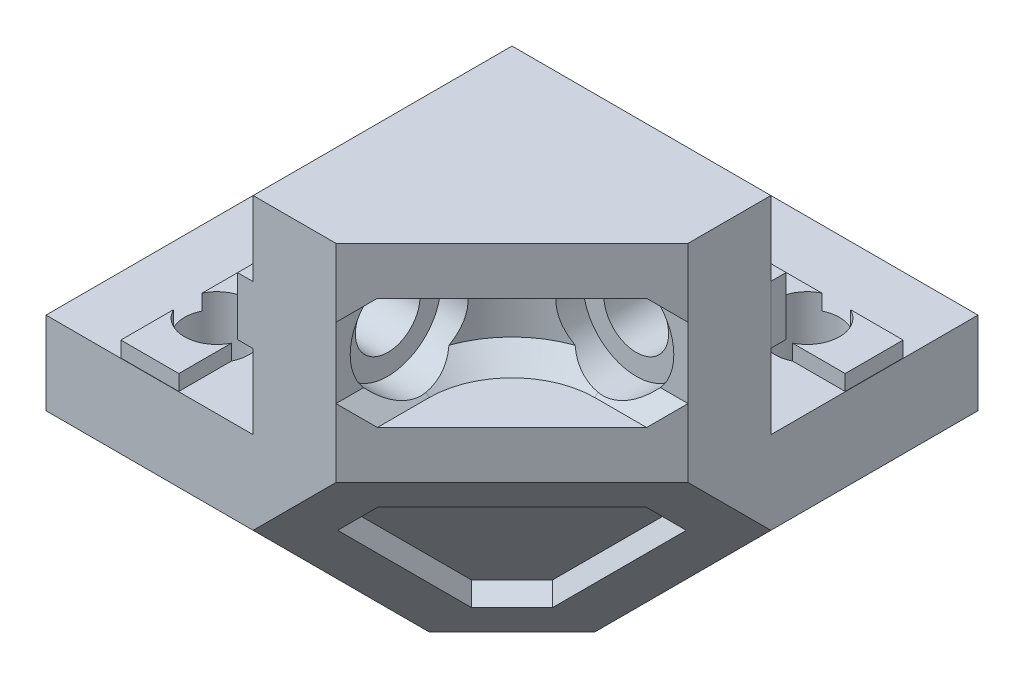
from build123d import *

# Parameters (mm, degrees)
EXTRUDE_C0_DEPTH        = 20
RIB8_REACH              = 42.62
SKETCH33_WALL_W         = 107.282014606
SKETCH33_WALL_H         = 4.6
RIB9_START              = -4.6
RIB9_DEPTH              = 4.6
FILLET2_R               = 10
SKETCH26_W              = 20
SKETCH26_H              = 1.5
BOSS_EXTRUDE13_DEPTH    = 2.8
SKETCH27_W              = 1.5
SKETCH27_H              = 20
BOSS_EXTRUDE14_DEPTH    = 2.8
CUT_EXTRUDE1_START      = 5
SKETCH10_R              = 3.125
CUT_EXTRUDE1_DEPTH      = 50
CUT_EXTRUDE2_START      = -6.5
SKETCH11_R              = 5.125
CUT_EXTRUDE2_DEPTH      = 50
CUT_EXTRUDE3_START      = 5
SKETCH12_R              = 3.125
CUT_EXTRUDE3_DEPTH      = 50
CUT_EXTRUDE4_START      = -6.5
SKETCH13_R              = 5.125
CUT_EXTRUDE4_DEPTH      = 50
CUT_EXTRUDE5_DEPTH      = 3
CHAMFER1_SIZE           = 2
PATTERN_LINEAR_C1_COUNT = 2
PATTERN_LINEAR_C1_PITCH = 30
C1ROT_ANGLE             = 90
PATTERN_LINEAR_C2_COUNT = 2
PATTERN_LINEAR_C2_PITCH = 30
C2ROT_ANGLE             = 90
C2MOV_ANGLE             = 90
SKETCH23_W              = 25
SKETCH23_H              = 25
BOSS_EXTRUDE11_DEPTH    = 25
CUT_EXTRUDE8_DEPTH      = 2


with BuildPart() as part:
    # corener side 1 → Extrude C0 (new body)
    with BuildSketch(Plane.XY):
        Polygon((0, 0), (0, -25), (8, -25), (8, -8), (25, -8), (25, 0), align=None)
    extrude(amount=-EXTRUDE_C0_DEPTH)

    # Sketch33 wall → Rib8 (add, up to next)
    with BuildSketch(Plane(origin=(16.5, -16.5, 0), x_dir=(0.707106781187, 0.707106781187, 0), z_dir=(-0.707106781187, 0.707106781187, 0)), mode=Mode.PRIVATE) as rib8_sk1:
        with Locations((0, 2.3)):
            Rectangle(SKETCH33_WALL_W, SKETCH33_WALL_H)
    rib8_tool1 = extrude(rib8_sk1.sketch, amount=RIB8_REACH, mode=Mode.PRIVATE) - part.part
    add(rib8_tool1.solids().sort_by_distance((16.5, -16.5, 0))[0])

    # Rib9: read off the stored shape, not the designer's step
    # Rib9 outline → Rib9 (add)
    with BuildSketch(Plane(origin=(0, 0, -20), x_dir=(-1, 0, 0), z_dir=(0, 0, -1)).offset(RIB9_START)):
        Polygon((-25, -8), (-8, -25), (-8, -8), align=None)
    extrude(amount=RIB9_DEPTH)

    # Fillet2
    fillet2_edges = [part.edges().sort_by_distance(p)[0] for p in [
        (8, -8, -10),
    ]]
    fillet(fillet2_edges, radius=FILLET2_R)

    # Sketch26 → Boss-Extrude13 (add, symmetric)
    with BuildSketch(Plane.XY.offset(-10)):
        with Locations((14.973723996, 0.75)):
            Rectangle(SKETCH26_W, SKETCH26_H)
    extrude(amount=BOSS_EXTRUDE13_DEPTH, both=True)

    # Sketch27 → Boss-Extrude14 (add, symmetric)
    with BuildSketch(Plane.XY.offset(-10)):
        with Locations((-0.75, -15)):
            Rectangle(SKETCH27_W, SKETCH27_H)
    extrude(amount=BOSS_EXTRUDE14_DEPTH, both=True)

    # Sketch10 → Cut-Extrude1 (cut)
    with BuildSketch(Plane.ZY.offset(CUT_EXTRUDE1_START)):
        with Locations(Location((-10, -18.5, 0), (0, 0, 333.637166921))):
            Circle(SKETCH10_R)
    extrude(amount=-CUT_EXTRUDE1_DEPTH, mode=Mode.SUBTRACT)

    # Sketch11 → Cut-Extrude2 (cut)
    with BuildSketch(Plane.ZY.offset(CUT_EXTRUDE2_START)):
        with Locations(Location((-10, -18.5, 0), (0, 0, 270))):
            Circle(SKETCH11_R)
    extrude(amount=-CUT_EXTRUDE2_DEPTH, mode=Mode.SUBTRACT)

    # Sketch12 → Cut-Extrude3 (cut)
    with BuildSketch(Plane(origin=(0, 0, 0), x_dir=(1, 0, 0), z_dir=(0, 1, 0)).offset(CUT_EXTRUDE3_START)):
        with Locations(Location((18.5, 10, 0), (0, 0, 243.637166921))):
            Circle(SKETCH12_R)
    extrude(amount=-CUT_EXTRUDE3_DEPTH, mode=Mode.SUBTRACT)

    # Sketch13 → Cut-Extrude4 (cut)
    with BuildSketch(Plane(origin=(0, 0, 0), x_dir=(1, 0, 0), z_dir=(0, 1, 0)).offset(CUT_EXTRUDE4_START)):
        with Locations(Location((18.5, 10, 0), (0, 0, 180))):
            Circle(SKETCH13_R)
    extrude(amount=-CUT_EXTRUDE4_DEPTH, mode=Mode.SUBTRACT)

    # Sketch14 → Cut-Extrude5 (cut, symmetric)
    with BuildSketch(Plane.XY.offset(-10)):
        Polygon((3.2, -1), (1, -3.2), (0, -3.2), (0, 0), (3.2, 0), align=None)
    extrude(amount=CUT_EXTRUDE5_DEPTH, both=True, mode=Mode.SUBTRACT)

    # Chamfer1
    # the kernel refuses this chamfer: 2 mm, written as the material it adds along each edge
    with BuildSketch(Plane(origin=(8, -25, -4.6), x_dir=(1, 0, 0), z_dir=(0, 1, 0))) as chamfer1_piece_1_section:
        Polygon((CHAMFER1_SIZE, 0), (0, CHAMFER1_SIZE), (0, 0), align=None)
    chamfer1_piece_1 = extrude(amount=7, mode=Mode.PRIVATE)
    chamfer1_piece_1 = split(chamfer1_piece_1, bisect_by=Plane(origin=(8, -25, -4.6), z_dir=(-0.7071067811865476, 0.7071067811865476, 0)), keep=Keep.TOP, mode=Mode.PRIVATE)
    chamfer1_piece_1 = chamfer1_piece_1 - Plane(origin=(8, -18.5, -10), x_dir=(0, -1, 0), z_dir=(-1, 0, 0)) * Cylinder(5.125, 22, mode=Mode.PRIVATE)
    add(chamfer1_piece_1)
    with BuildSketch(Plane(origin=(18, -8, -4.6), x_dir=(0, -1, 0), z_dir=(1, 0, 0))) as chamfer1_piece_2_section:
        Polygon((CHAMFER1_SIZE, 0), (0, CHAMFER1_SIZE), (0, 0), align=None)
    chamfer1_piece_2 = extrude(amount=7, mode=Mode.PRIVATE)
    chamfer1_piece_2 = split(chamfer1_piece_2, bisect_by=Plane(origin=(21.5, -11.5, -4.6), z_dir=(-0.7071067811865476, 0.7071067811865476, 0)), keep=Keep.TOP, mode=Mode.PRIVATE)
    chamfer1_piece_2 = chamfer1_piece_2 - Plane(origin=(18.5, -8, -10), x_dir=(-1, 0, 0), z_dir=(0, 1, 0)) * Cylinder(5.125, 22, mode=Mode.PRIVATE)
    add(chamfer1_piece_2)
    with BuildSketch(Plane(origin=(18, -18, -4.6), x_dir=(-1, 0, 0), z_dir=(0, -1, 0))) as chamfer1_piece_3_section:
        Polygon((10 - CHAMFER1_SIZE, 0), (10, CHAMFER1_SIZE), (10, 0), align=None)
    chamfer1_piece_3 = revolve(axis=Axis((18, -18, -4.6), (0, 0, -1)), revolution_arc=90, mode=Mode.PRIVATE)
    chamfer1_piece_3 = chamfer1_piece_3 - Plane(origin=(18, -18.5, -10), x_dir=(0, -1, 0), z_dir=(-1, 0, 0)) * Cylinder(5.125, 40, mode=Mode.PRIVATE)
    chamfer1_piece_3 = chamfer1_piece_3 - Plane(origin=(18.5, -18, -10), x_dir=(-1, 0, 0), z_dir=(0, 1, 0)) * Cylinder(5.125, 40, mode=Mode.PRIVATE)
    add(chamfer1_piece_3)
    with BuildSketch(Plane(origin=(18, -8, -15.4), x_dir=(0, 0, 1), z_dir=(1, 0, 0))) as chamfer1_piece_4_section:
        Polygon((CHAMFER1_SIZE, 0), (0, CHAMFER1_SIZE), (0, 0), align=None)
    chamfer1_piece_4 = extrude(amount=7, mode=Mode.PRIVATE)
    chamfer1_piece_4 = chamfer1_piece_4 - Plane(origin=(18.5, -8, -10), x_dir=(-1, 0, 0), z_dir=(0, 1, 0)) * Cylinder(5.125, 22, mode=Mode.PRIVATE)
    chamfer1_piece_4 = split(chamfer1_piece_4, bisect_by=Plane(origin=(21.5, -11.5, -15.4), z_dir=(-0.7071067811865476, 0.7071067811865476, 0)), keep=Keep.TOP, mode=Mode.PRIVATE)
    add(chamfer1_piece_4)
    with BuildSketch(Plane(origin=(8, -25, -15.4), x_dir=(0, 0, 1), z_dir=(0, 1, 0))) as chamfer1_piece_5_section:
        Polygon((CHAMFER1_SIZE, 0), (0, CHAMFER1_SIZE), (0, 0), align=None)
    chamfer1_piece_5 = extrude(amount=7, mode=Mode.PRIVATE)
    chamfer1_piece_5 = chamfer1_piece_5 - Plane(origin=(8, -18.5, -10), x_dir=(0, -1, 0), z_dir=(-1, 0, 0)) * Cylinder(5.125, 22, mode=Mode.PRIVATE)
    chamfer1_piece_5 = split(chamfer1_piece_5, bisect_by=Plane(origin=(8, -25, -15.4), z_dir=(-0.7071067811865476, 0.7071067811865476, 0)), keep=Keep.TOP, mode=Mode.PRIVATE)
    add(chamfer1_piece_5)
    with BuildSketch(Plane(origin=(18, -18, -15.4), x_dir=(-1, 0, 0), z_dir=(0, -1, 0))) as chamfer1_piece_6_section:
        Polygon((10, -CHAMFER1_SIZE), (10 - CHAMFER1_SIZE, 0), (10, 0), align=None)
    chamfer1_piece_6 = revolve(axis=Axis((18, -18, -15.4), (0, 0, -1)), revolution_arc=90, mode=Mode.PRIVATE)
    chamfer1_piece_6 = chamfer1_piece_6 - Plane(origin=(18, -18.5, -10), x_dir=(0, -1, 0), z_dir=(-1, 0, 0)) * Cylinder(5.125, 40, mode=Mode.PRIVATE)
    chamfer1_piece_6 = chamfer1_piece_6 - Plane(origin=(18.5, -18, -10), x_dir=(-1, 0, 0), z_dir=(0, 1, 0)) * Cylinder(5.125, 40, mode=Mode.PRIVATE)
    add(chamfer1_piece_6)


with BuildPart() as pattern_linear_c1_1:
    # Pattern Linear C1: pattern copy
    add(part.part.moved(Location(Vector(0, 0, -1) * (1 * PATTERN_LINEAR_C1_PITCH))))


with BuildPart() as pattern_linear_c1_1_1:
    # C1Rot: moved
    add(pattern_linear_c1_1.part.rotate(Axis((11, 0, -40), (0, -1, 0)), C1ROT_ANGLE))


with BuildPart() as pattern_linear_c1_1_2:
    # C1Mov: read off the stored shape, not the designer's step
    # C1Mov: moved
    add(pattern_linear_c1_1_1.part.moved(Location((-21, 0, 51))))


with BuildPart() as pattern_linear_c2_1:
    # Pattern Linear C2: pattern copy
    add(pattern_linear_c1_1_2.part.moved(Location(Vector(1, 0, 0) * (1 * PATTERN_LINEAR_C2_PITCH))))


with BuildPart() as pattern_linear_c2_1_1:
    # C2Rot: moved
    add(pattern_linear_c2_1.part.rotate(Axis((0, -11, -70), (-1, 0, 0)), C2ROT_ANGLE))


with BuildPart() as pattern_linear_c2_1_2:
    # C2Mov: read off the stored shape, not the designer's step
    # C2Mov: moved
    add(pattern_linear_c2_1_1.part.moved(Location((-30, -59, 81))).rotate(Axis((0, 0, 0), (0, 0, -1)), C2MOV_ANGLE))


with BuildPart() as part_1:
    add(part.part)

    add(pattern_linear_c1_1_2.part)  # Boss-Extrude11 merges Pattern Linear C1_1

    add(pattern_linear_c2_1_2.part)  # Boss-Extrude11 merges Pattern Linear C2_1
    # Sketch23 → Boss-Extrude11 (add)
    with BuildSketch(Plane.XY):
        with Locations((12.5, -12.5)):
            Rectangle(SKETCH23_W, SKETCH23_H)
    extrude(amount=BOSS_EXTRUDE11_DEPTH)

    # SurfaceCut2
    split(bisect_by=Plane(origin=(11, -11, 11), x_dir=(-0.40824829046386213, 0.408248290463853, 0.8164965809277316), z_dir=(-0.5773502691896365, 0.577350269189623, -0.5773502691896181)), keep=Keep.TOP)

    # Sketch37 → Cut-Extrude8 (cut)
    with BuildSketch(Plane(origin=(11, -11, 11), x_dir=(0.4082482904638624, -0.4082482904638528, -0.8164965809277315), z_dir=(0.5773502691896361, -0.5773502691896232, 0.5773502691896182))):
        Polygon((-12.146428199, -2.770102904), (3.674234614, -11.904166838), (8.472193585, -9.134063934), (8.472193585, 9.134063934), (3.674234614, 11.904166838), (-12.146428199, 2.770102904), align=None)
    extrude(amount=-CUT_EXTRUDE8_DEPTH, mode=Mode.SUBTRACT)


solid = part_1.part
